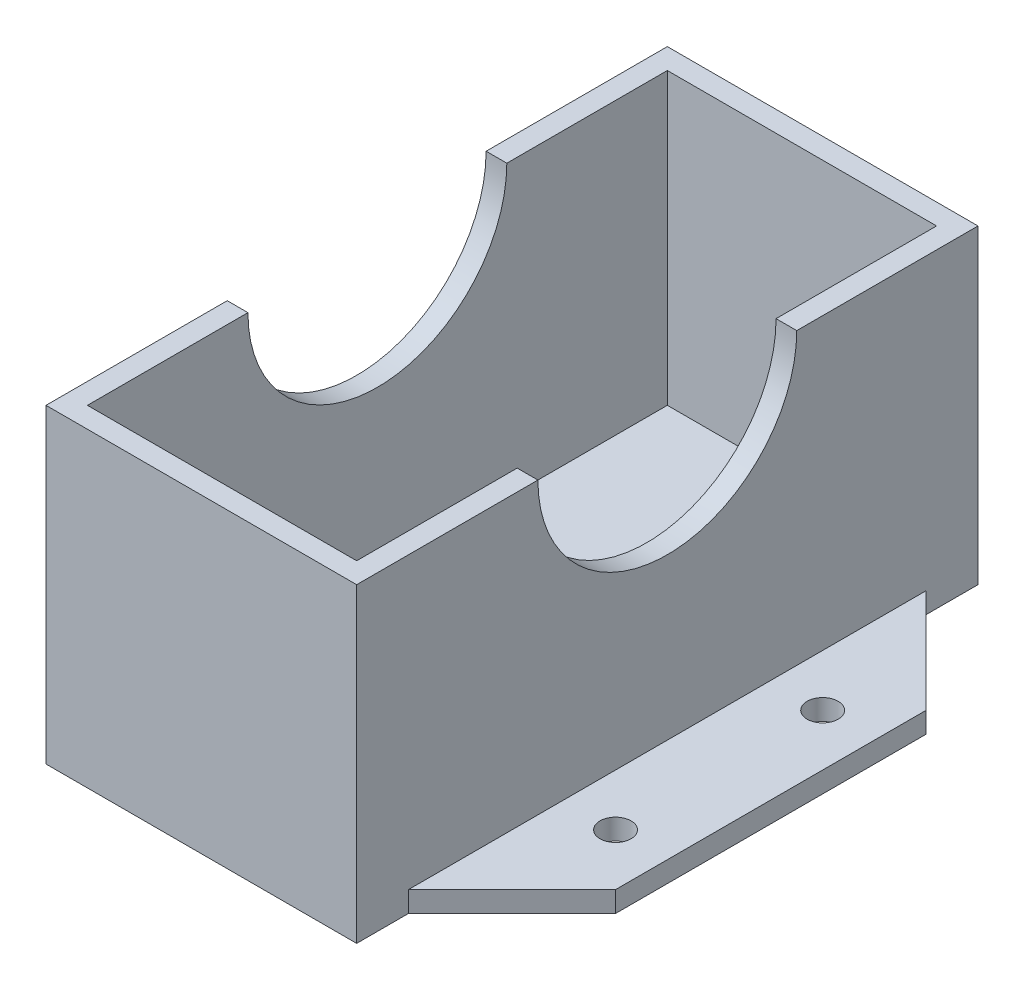
from build123d import *

# Parameters (mm, degrees)
SKETCH1_R           = 1.5
BOSS_EXTRUDE1_DEPTH = 2
SKETCH2_W           = 30
SKETCH2_H           = 60
SKETCH2_W_2         = 26
SKETCH2_H_2         = 56
BOSS_EXTRUDE2_DEPTH = 28
SKETCH3_R           = 12.5
CUT_EXTRUDE1_DEPTH  = 59.309518948


with BuildPart() as part:
    # Sketch1 → Boss-Extrude1 (new body)
    with BuildSketch(Plane(origin=(0, 0, 0), x_dir=(1, 0, 0), z_dir=(0, 1, 0))):
        Polygon((0, -30), (0, 30), (-15, 30), (-15, 25), (-25, 15), (-25, -15), (-15, -25), (-15, -30), align=None)
        with Locations((-20, 10)):
            Circle(SKETCH1_R, mode=Mode.SUBTRACT)
        with Locations((-20, -10)):
            Circle(SKETCH1_R, mode=Mode.SUBTRACT)
    boss_extrude1 = extrude(amount=BOSS_EXTRUDE1_DEPTH)

    # Mirror1: Boss-Extrude1 across plane
    add(boss_extrude1.mirror(Plane(origin=(0, 0, 0), x_dir=(0, 0, 1), z_dir=(1, 0, 0))))

    # Sketch2 → Boss-Extrude2 (add)
    with BuildSketch(Plane(origin=(0, 2, 0), x_dir=(1, 0, 0), z_dir=(0, 1, 0))):
        Rectangle(SKETCH2_W, SKETCH2_H)
        Rectangle(SKETCH2_W_2, SKETCH2_H_2, mode=Mode.SUBTRACT)
    extrude(amount=BOSS_EXTRUDE2_DEPTH)

    # Sketch3 → Cut-Extrude1 (cut, through all)
    with BuildSketch(Plane(origin=(15, 0, 0), x_dir=(0, 0, -1), z_dir=(1, 0, 0))):
        with Locations((0, 30)):
            Circle(SKETCH3_R)
    extrude(amount=-CUT_EXTRUDE1_DEPTH, mode=Mode.SUBTRACT)


solid = part.part
